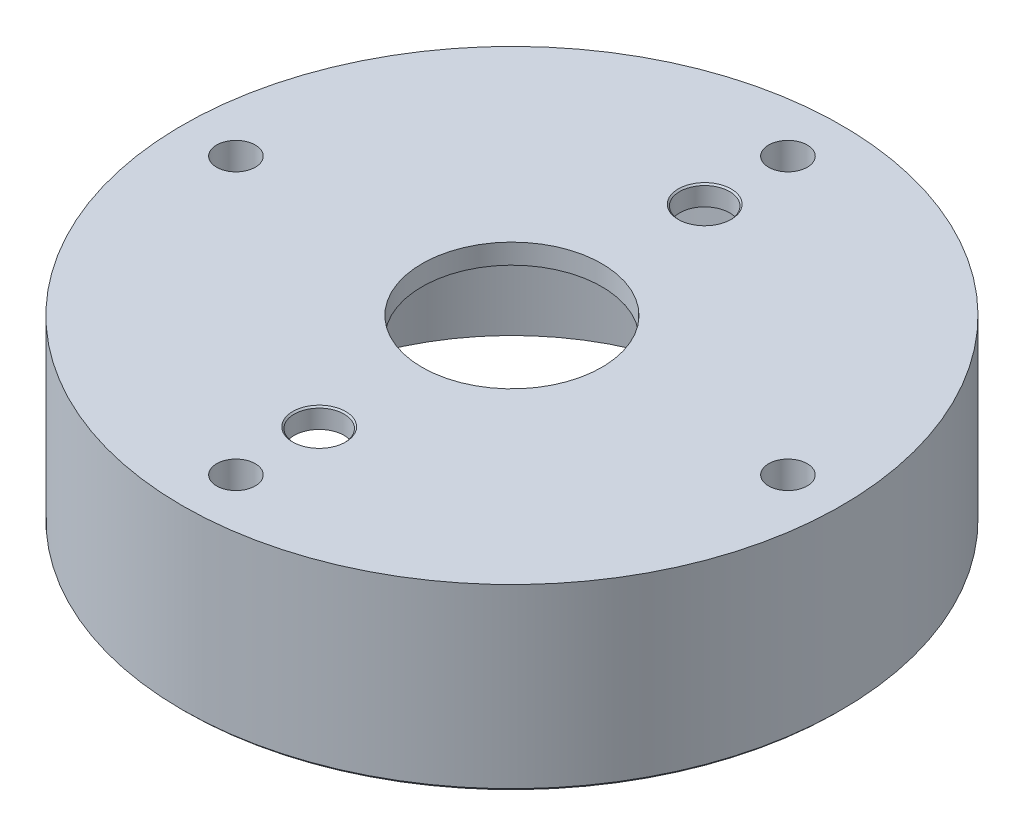
from build123d import *

# Parameters (mm, degrees)
SKETCH1_R           = 16.5
SKETCH1_R_2         = 11.5
BOSS_EXTRUDE1_DEPTH = 8
SKETCH2_R           = 16.5
BOSS_EXTRUDE2_DEPTH = 1
SKETCH3_R           = 1.25
SKETCH3_R_2         = 4.5
CUT_EXTRUDE1_DEPTH  = 9.65
SCALE1_SCALE        = 1.666666667
CHAMFER2_SIZE       = 0.125
CHAMFER4_SIZE       = 0.25
SKETCH4_R           = 1.6125
CUT_EXTRUDE2_DEPTH  = 42.683330001


with BuildPart() as part:
    # Sketch1 → Boss-Extrude1 (new body)
    with BuildSketch(Plane(origin=(0, 0, 0), x_dir=(1, 0, 0), z_dir=(0, 1, 0))):
        Circle(SKETCH1_R)
        Circle(SKETCH1_R_2, mode=Mode.SUBTRACT)
    extrude(amount=BOSS_EXTRUDE1_DEPTH)

    # Sketch2 → Boss-Extrude2 (add)
    with BuildSketch(Plane(origin=(0, 8, 0), x_dir=(1, 0, 0), z_dir=(0, 1, 0))):
        Circle(SKETCH2_R)
    extrude(amount=BOSS_EXTRUDE2_DEPTH)

    # Sketch3 → Cut-Extrude1 (cut)
    with BuildSketch(Plane(origin=(0, 9, 0), x_dir=(1, 0, 0), z_dir=(0, 1, 0))):
        with Locations((0, 9.65)):
            Circle(SKETCH3_R)
        with Locations((0, -9.65)):
            Circle(SKETCH3_R)
        Circle(SKETCH3_R_2)
    extrude(amount=-CUT_EXTRUDE1_DEPTH, mode=Mode.SUBTRACT)


with BuildPart() as part_1:
    # Scale1: scaled about (0, 4.818144462, 0)
    add(part.part.scale(SCALE1_SCALE).moved(Location((0, -3.212096308, 0))))

    # Chamfer2
    chamfer2_edges = [part_1.edges().sort_by_distance(p)[0] for p in [
        (-2.083333333, 11.787903692, -16.083333333),
        (-2.083333333, 11.787903692, 16.083333333),
    ]]
    chamfer(chamfer2_edges, length=CHAMFER2_SIZE)

    # Chamfer4
    chamfer4_edges = [part_1.edges().sort_by_distance(p)[0] for p in [
        (-27.5, -3.212096308, 0),
    ]]
    chamfer(chamfer4_edges, length=CHAMFER4_SIZE)

    # Sketch4 → Cut-Extrude2 (cut, through all)
    with BuildSketch(Plane(origin=(0, 11.787903692, 0), x_dir=(1, 0, 0), z_dir=(0, 1, 0))):
        with Locations((23.03, 0)):
            Circle(SKETCH4_R)
        with Locations((0, 23.03)):
            Circle(SKETCH4_R)
        with Locations((0, -23.03)):
            Circle(SKETCH4_R)
        with Locations((-23.03, 0)):
            Circle(SKETCH4_R)
    extrude(amount=-CUT_EXTRUDE2_DEPTH, mode=Mode.SUBTRACT)


solid = part_1.part
